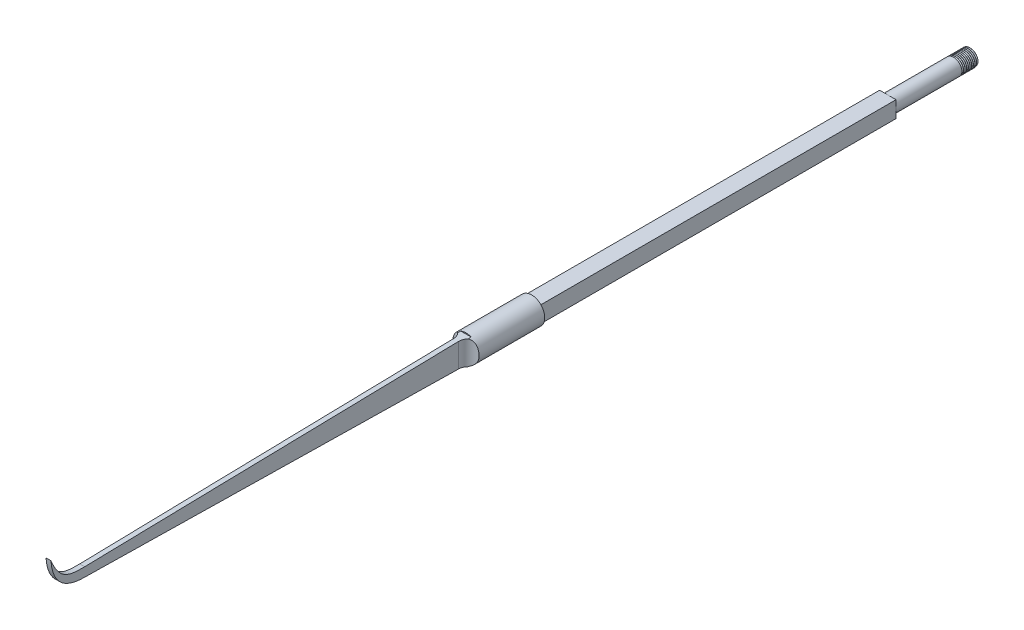
from build123d import *

# Parameters (mm, degrees)
SKETCH1_R                = 2.5
BOSS_EXTRUDE1_DEPTH      = 25
SKETCH2_W                = 5
SKETCH2_H                = 5
BOSS_EXTRUDE2_DEPTH      = 108.5
SKETCH3_R                = 4
BOSS_EXTRUDE3_DEPTH      = 20
BOSS_EXTRUDE4_DEPTH      = 0.75
BOSS_EXTRUDE4_DEPTH_BACK = 0.75
CUT_EXTRUDE1_START       = -23.25
SKETCH5_R                = 4.5
SKETCH5_R_2              = 4
CUT_EXTRUDE1_DEPTH       = 23.25
FILLET1_R                = 3
CUT_SWEEP1_PITCH         = 0.5


with BuildPart() as part:
    # Sketch1 → Boss-Extrude1 (new body)
    with BuildSketch(Plane.XY):
        Circle(SKETCH1_R)
    extrude(amount=BOSS_EXTRUDE1_DEPTH)

    # Sketch2 → Boss-Extrude2 (add)
    with BuildSketch(Plane.XY.offset(25)):
        Rectangle(SKETCH2_W, SKETCH2_H)
    extrude(amount=BOSS_EXTRUDE2_DEPTH)

    # Sketch3 → Boss-Extrude3 (add)
    with BuildSketch(Plane.XY.offset(133.5)):
        Circle(SKETCH3_R)
    extrude(amount=BOSS_EXTRUDE3_DEPTH)

    # Sketch4 → Boss-Extrude4 (add, two sides: drawn at the far end of the back side and taken through both)
    with BuildSketch(Plane(origin=(0, 0, 0), x_dir=(0, 0, -1), z_dir=(1, 0, 0)).offset(-BOSS_EXTRUDE4_DEPTH_BACK)):
        with BuildLine():
            Line((-138.505062892, 4.009925429), (-270.390194926, 1.114437793))
            add(Edge.make_bspline(
                [(-270.390194926, 1.114437793), (-275.565737389, 1.000810737), (-278.082575027, 1.695650016), (-280.665495526, 7.849471516)],
                knots=[0, 0, 0, 0, 1, 1, 1, 1], degree=3))
            add(Edge.make_bspline(
                [(-270.75260847, -1.637223833), (-276.627526376, -1.531491488), (-280.209348695, 1.429792663), (-280.665495526, 7.849471516)],
                knots=[0, 0, 0, 0, 1, 1, 1, 1], degree=3))
            Line((-270.75260847, -1.637223833), (-138.522922138, -3.990074571))
            Line((-138.522922138, -3.990074571), (-138.505062892, 4.009925429))
        make_face()
    extrude(amount=BOSS_EXTRUDE4_DEPTH + BOSS_EXTRUDE4_DEPTH_BACK)

    # Sketch5 → Cut-Extrude1 (cut)
    with BuildSketch(Plane.XY.offset(153.5).offset(CUT_EXTRUDE1_START)):
        Circle(SKETCH5_R)
        Circle(SKETCH5_R_2, mode=Mode.SUBTRACT)
    extrude(amount=CUT_EXTRUDE1_DEPTH, mode=Mode.SUBTRACT)

    # Fillet1
    # the kernel refuses this fillet: 3 mm, written as the material it adds along each edge
    with BuildSketch(Plane(origin=(0.75, -11.223577465, 153.5), x_dir=(1, 0, 0), z_dir=(0, 1, 0))) as fillet1_piece_1_section:
        with BuildLine():
            CenterArc((FILLET1_R, -FILLET1_R), FILLET1_R, 90, 90)
            Line((0, -FILLET1_R), (0, 0))
            Line((0, 0), (FILLET1_R, 0))
        make_face()
    fillet1_piece_1 = extrude(amount=22.404294785, mode=Mode.PRIVATE)
    fillet1_piece_1 = fillet1_piece_1 & Plane(origin=(0, 0, 153.5), x_dir=(1, 0, 0), z_dir=(0, 0, -1)) * Cylinder(4, 57, mode=Mode.PRIVATE)
    fillet1_piece_1 = split(fillet1_piece_1, bisect_by=Plane(origin=(0.75, -3.725951322, 153.366589752), z_dir=(0, 0.9998417303253057, -0.017790848773981145)), keep=Keep.TOP, mode=Mode.PRIVATE)
    fillet1_piece_1 = split(fillet1_piece_1, bisect_by=Plane(origin=(0.75, 3.673536833, 153.827060447), z_dir=(0, -0.9997590844721354, -0.021949328359603587)), keep=Keep.TOP, mode=Mode.PRIVATE)
    add(fillet1_piece_1)
    with BuildSketch(Plane(origin=(-0.75, -11.223577465, 153.5), x_dir=(-1, 0, 0), z_dir=(0, 1, 0))) as fillet1_piece_2_section:
        with BuildLine():
            CenterArc((FILLET1_R, FILLET1_R), FILLET1_R, 180, 90)
            Line((0, FILLET1_R), (0, 0))
            Line((0, 0), (FILLET1_R, 0))
        make_face()
    fillet1_piece_2 = extrude(amount=22.404294785, mode=Mode.PRIVATE)
    fillet1_piece_2 = fillet1_piece_2 & Plane(origin=(0, 0, 153.5), x_dir=(1, 0, 0), z_dir=(0, 0, -1)) * Cylinder(4, 57, mode=Mode.PRIVATE)
    fillet1_piece_2 = split(fillet1_piece_2, bisect_by=Plane(origin=(-0.75, -3.725951322, 153.366589752), z_dir=(0, 0.9998417303253057, -0.017790848773981145)), keep=Keep.TOP, mode=Mode.PRIVATE)
    fillet1_piece_2 = split(fillet1_piece_2, bisect_by=Plane(origin=(-0.75, 3.673536833, 153.827060447), z_dir=(0, -0.9997590844721354, -0.021949328359603587)), keep=Keep.TOP, mode=Mode.PRIVATE)
    add(fillet1_piece_2)

    # Cut-Sweep1: arcs per turn and ends read off the stored shape
    # Cut-Sweep1: the profile of Sketch7 screwed along a right-hand helix through 11 turns, 6 arcs to a turn; built about Z, then put on its axis
    cut_sweep1_z = Axis((0, 0, 0), (0, 0, 1))
    cut_sweep1_corners = [(2.109213008, -5.0136e-05, -0.498424926), (2.517063273, -0.00810239, -0.245455912), (2.532326691, 0.007161027, -0.724970309)]
    with BuildLine(mode=Mode.PRIVATE) as cut_sweep1_profile:
        Line(cut_sweep1_corners[0], cut_sweep1_corners[1])
        Line(cut_sweep1_corners[1], cut_sweep1_corners[2])
        Line(cut_sweep1_corners[2], cut_sweep1_corners[0])
    cut_sweep1_cap = Face(cut_sweep1_profile.wire())
    cut_sweep1_turn_angles = [0, 30, 60, 90, 120, 150, 180, 210, 240, 270, 300, 330, 360]
    cut_sweep1_turn_weights = [1, 0.8660254037844387, 1, 0.8660254037844387, 1, 0.8660254037844387, 1, 0.8660254037844387, 1, 0.8660254037844387, 1, 0.8660254037844387, 1]
    cut_sweep1_turn_rails = [Edge.make_bspline([Vector(p[0], p[1], 0).rotate(cut_sweep1_z, cut_sweep1_turn_angles[k]) / cut_sweep1_turn_weights[k] + Vector(0, 0, p[2] + CUT_SWEEP1_PITCH * cut_sweep1_turn_angles[k] / 360) for k in range(13)], [0, 0, 0, 1, 1, 2, 2, 3, 3, 4, 4, 5, 5, 6, 6, 6], 2, cut_sweep1_turn_weights) for p in cut_sweep1_corners]
    cut_sweep1_turn_sides = [Face.make_surface_from_curves(cut_sweep1_turn_rails[p[0]], cut_sweep1_turn_rails[p[1]]) for p in [(0, 1), (1, 2), (2, 0)]]
    cut_sweep1 = Plane(origin=(0, 0, 0), x_dir=(-0.7071067811865561, -0.7071067811865389, 0), z_dir=(0, 0, 1)) * Solid(Shell([*[p.moved(Location((0, 0, CUT_SWEEP1_PITCH * i))) for i in range(11) for p in cut_sweep1_turn_sides], cut_sweep1_cap, cut_sweep1_cap.rotate(cut_sweep1_z, 3960).moved(Location((0, 0, CUT_SWEEP1_PITCH * 3960 / 360)))]))
    add(cut_sweep1, mode=Mode.SUBTRACT)


solid = part.part
